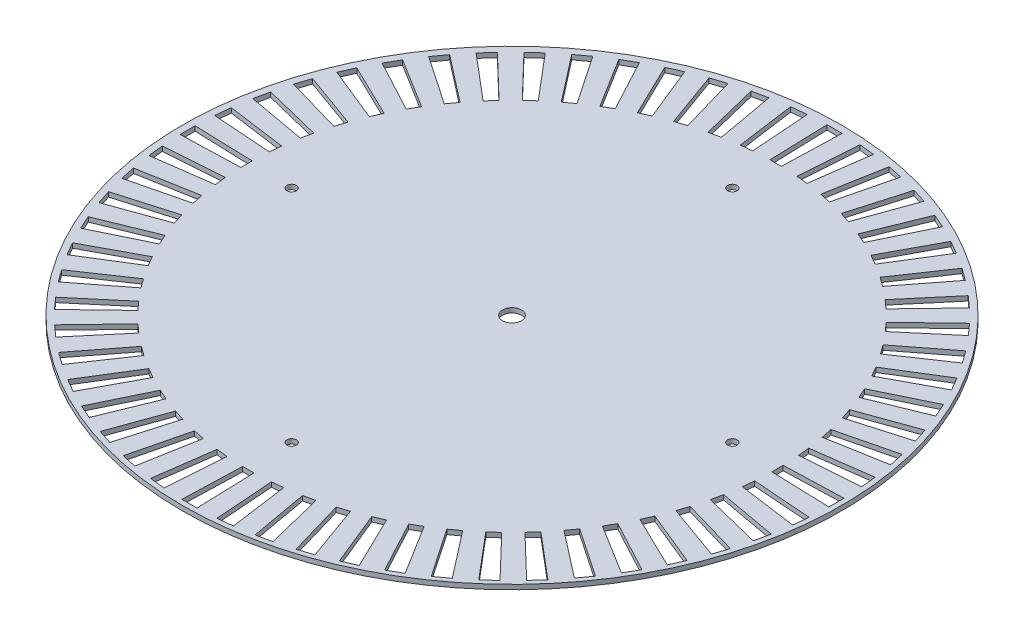
from build123d import *

# Parameters (mm, degrees)
SKETCH1_R           = 35
SKETCH1_R_2         = 1
BOSS_EXTRUDE2_DEPTH = 0.5
SKETCH2_R           = 0.5
CUT_EXTRUDE1_DEPTH  = 0.5


with BuildPart() as part:
    # Sketch1 → Boss-Extrude2 (new body)
    with BuildSketch(Plane(origin=(0, 0, 0), x_dir=(1, 0, 0), z_dir=(0, 1, 0))):
        Circle(SKETCH1_R)
        Circle(SKETCH1_R_2, mode=Mode.SUBTRACT)
    extrude(amount=BOSS_EXTRUDE2_DEPTH)

    # Sketch2 → Cut-Extrude1 (cut)
    with BuildSketch(Plane(origin=(0, 0.5, 0), x_dir=(1, 0, 0), z_dir=(0, 1, 0))):
        with Locations((0, 23.399787233)):
            Circle(SKETCH2_R)
        with Locations((23.399787233, 0)):
            Circle(SKETCH2_R)
        with Locations((0, -23.399787233)):
            Circle(SKETCH2_R)
        with Locations((-23.399787233, 0)):
            Circle(SKETCH2_R)
        Polygon((-0.8, 34.254863747), (0.8, 34.254863747), (0.6, 28.000059262), (-0.6, 28.000059262), align=None)
        Polygon((2.795991407, 34.160739826), (4.38722644, 33.993494284), (3.53451696, 27.793859966), (2.341090686, 27.919294122), align=None)
        Polygon((6.362444969, 33.691248069), (7.92748113, 33.358589364), (6.431404634, 27.282049702), (5.257627513, 27.531543731), align=None)
        Polygon((9.860285873, 32.851532328), (11.381976299, 32.357105137), (9.258924113, 26.470235972), (8.117656294, 26.841056365), align=None)
        Polygon((13.251191042, 31.650792703), (14.712863774, 31.000014074), (11.986096503, 25.367313177), (10.889841954, 25.855397148), align=None)
        Polygon((16.49800901, 30.102184748), (17.883649656, 29.302184748), (14.583042333, 23.985365169), (13.543811848, 24.585365169), align=None)
        Polygon((19.56516696, 28.222675338), (20.859594151, 27.282218934), (17.02130892, 22.33953286), (16.050488527, 23.044875163), align=None)
        Polygon((22.419060467, 26.032856769), (23.608092188, 24.962247799), (19.274182105, 20.447848333), (18.382408315, 21.250805061), align=None)
        Polygon((25.028421678, 23.556721153), (26.099030648, 22.367689432), (21.316978939, 18.33103728), (20.514022212, 19.222811071), align=None)
        Polygon((27.364661884, 20.82139755), (28.305118287, 19.526970359), (23.127318112, 16.012291926), (22.421975809, 16.983112319), align=None)
        Polygon((29.402184748, 17.856854737), (30.202184748, 16.471214091), (24.685365169, 13.517016929), (24.085365169, 14.556247414), align=None)
        Polygon((31.118666745, 14.695572866), (31.769445374, 13.233900133), (25.97404982, 10.872551046), (25.485965848, 11.968805595), align=None)
        Polygon((32.495301738, 11.372187602), (32.989728929, 9.850497176), (26.979252967, 8.107867597), (26.608432573, 9.249135416), align=None)
        Polygon((33.517007026, 7.92311065), (33.849665731, 6.358074489), (27.689961393, 5.253257033), (27.440467364, 6.427034154), align=None)
        Polygon((34.172588592, 4.386130819), (34.339834133, 2.794895786), (28.098388429, 2.339995065), (27.972954273, 3.533421339), align=None)
        Polygon((34.454863747, 0.8), (34.454863747, -0.8), (28.200059262, -0.6), (28.200059262, 0.6), align=None)
        Polygon((34.360739826, -2.795991407), (34.193494284, -4.38722644), (27.993859966, -3.53451696), (28.119294122, -2.341090686), align=None)
        Polygon((33.891248069, -6.362444969), (33.558589364, -7.92748113), (27.482049702, -6.431404634), (27.731543731, -5.257627513), align=None)
        Polygon((33.051532328, -9.860285873), (32.557105137, -11.381976299), (26.670235972, -9.258924113), (27.041056365, -8.117656293), align=None)
        Polygon((31.850792703, -13.251191042), (31.200014074, -14.712863774), (25.567313177, -11.986096503), (26.055397148, -10.889841954), align=None)
        Polygon((30.302184748, -16.49800901), (29.502184748, -17.883649656), (24.185365169, -14.583042333), (24.785365169, -13.543811848), align=None)
        Polygon((28.422675338, -19.56516696), (27.482218934, -20.859594151), (22.53953286, -17.02130892), (23.244875163, -16.050488527), align=None)
        Polygon((26.232856769, -22.419060467), (25.162247799, -23.608092188), (20.647848333, -19.274182105), (21.450805061, -18.382408315), align=None)
        Polygon((23.756721153, -25.028421678), (22.567689432, -26.099030648), (18.53103728, -21.316978939), (19.422811071, -20.514022212), align=None)
        Polygon((21.02139755, -27.364661884), (19.726970359, -28.305118287), (16.212291926, -23.127318112), (17.183112319, -22.421975809), align=None)
        Polygon((18.056854737, -29.402184748), (16.671214091, -30.202184748), (13.717016929, -24.685365169), (14.756247414, -24.085365169), align=None)
        Polygon((14.895572866, -31.118666745), (13.433900133, -31.769445374), (11.072551046, -25.97404982), (12.168805595, -25.485965848), align=None)
        Polygon((11.572187602, -32.495301738), (10.050497176, -32.989728929), (8.307867597, -26.979252967), (9.449135416, -26.608432573), align=None)
        Polygon((8.12311065, -33.517007026), (6.558074489, -33.849665731), (5.453257033, -27.689961393), (6.627034154, -27.440467364), align=None)
        Polygon((4.586130819, -34.172588592), (2.994895786, -34.339834133), (2.539995065, -28.098388429), (3.733421339, -27.972954273), align=None)
        Polygon((1, -34.454863747), (-0.6, -34.454863747), (-0.4, -28.200059262), (0.8, -28.200059262), align=None)
        Polygon((-2.595991407, -34.360739826), (-4.18722644, -34.193494284), (-3.33451696, -27.993859966), (-2.141090686, -28.119294122), align=None)
        Polygon((-6.162444969, -33.891248069), (-7.72748113, -33.558589364), (-6.231404634, -27.482049702), (-5.057627513, -27.731543731), align=None)
        Polygon((-9.660285873, -33.051532328), (-11.181976299, -32.557105137), (-9.058924113, -26.670235972), (-7.917656293, -27.041056365), align=None)
        Polygon((-13.051191042, -31.850792703), (-14.512863774, -31.200014074), (-11.786096503, -25.567313177), (-10.689841954, -26.055397148), align=None)
        Polygon((-16.29800901, -30.302184748), (-17.683649656, -29.502184748), (-14.383042333, -24.185365169), (-13.343811848, -24.785365169), align=None)
        Polygon((-19.36516696, -28.422675338), (-20.659594151, -27.482218934), (-16.82130892, -22.53953286), (-15.850488527, -23.244875163), align=None)
        Polygon((-22.219060467, -26.232856769), (-23.408092188, -25.162247799), (-19.074182105, -20.647848333), (-18.182408315, -21.450805061), align=None)
        Polygon((-24.828421678, -23.756721153), (-25.899030648, -22.567689432), (-21.116978939, -18.53103728), (-20.314022212, -19.422811071), align=None)
        Polygon((-27.164661884, -21.02139755), (-28.105118287, -19.726970359), (-22.927318112, -16.212291926), (-22.221975809, -17.183112319), align=None)
        Polygon((-29.202184748, -18.056854737), (-30.002184748, -16.671214091), (-24.485365169, -13.717016929), (-23.885365169, -14.756247414), align=None)
        Polygon((-30.918666745, -14.895572866), (-31.569445374, -13.433900133), (-25.77404982, -11.072551046), (-25.285965848, -12.168805595), align=None)
        Polygon((-32.295301738, -11.572187602), (-32.789728929, -10.050497176), (-26.779252967, -8.307867597), (-26.408432573, -9.449135416), align=None)
        Polygon((-33.317007026, -8.12311065), (-33.649665731, -6.558074489), (-27.489961393, -5.453257033), (-27.240467364, -6.627034154), align=None)
        Polygon((-33.972588592, -4.586130819), (-34.139834133, -2.994895786), (-27.898388429, -2.539995065), (-27.772954273, -3.733421339), align=None)
        Polygon((-34.254863747, -1), (-34.254863747, 0.6), (-28.000059262, 0.4), (-28.000059262, -0.8), align=None)
        Polygon((-34.160739826, 2.595991407), (-33.993494284, 4.18722644), (-27.793859966, 3.33451696), (-27.919294122, 2.141090686), align=None)
        Polygon((-33.691248069, 6.162444969), (-33.358589364, 7.72748113), (-27.282049702, 6.231404634), (-27.531543731, 5.057627513), align=None)
        Polygon((-32.851532328, 9.660285873), (-32.357105137, 11.181976299), (-26.470235972, 9.058924113), (-26.841056365, 7.917656294), align=None)
        Polygon((-31.650792703, 13.051191042), (-31.000014074, 14.512863774), (-25.367313177, 11.786096503), (-25.855397148, 10.689841954), align=None)
        Polygon((-30.102184748, 16.29800901), (-29.302184748, 17.683649656), (-23.985365169, 14.383042333), (-24.585365169, 13.343811848), align=None)
        Polygon((-28.222675338, 19.36516696), (-27.282218934, 20.659594151), (-22.33953286, 16.82130892), (-23.044875163, 15.850488527), align=None)
        Polygon((-26.032856769, 22.219060467), (-24.962247799, 23.408092188), (-20.447848333, 19.074182105), (-21.250805061, 18.182408315), align=None)
        Polygon((-23.556721153, 24.828421678), (-22.367689432, 25.899030648), (-18.33103728, 21.116978939), (-19.222811071, 20.314022212), align=None)
        Polygon((-20.82139755, 27.164661884), (-19.526970359, 28.105118287), (-16.012291926, 22.927318112), (-16.983112319, 22.221975809), align=None)
        Polygon((-17.856854737, 29.202184748), (-16.471214091, 30.002184748), (-13.517016929, 24.485365169), (-14.556247414, 23.885365169), align=None)
        Polygon((-14.695572866, 30.918666745), (-13.233900133, 31.569445374), (-10.872551046, 25.77404982), (-11.968805595, 25.285965848), align=None)
        Polygon((-11.372187602, 32.295301738), (-9.850497176, 32.789728929), (-8.107867597, 26.779252967), (-9.249135416, 26.408432573), align=None)
        Polygon((-7.92311065, 33.317007026), (-6.358074489, 33.649665731), (-5.253257033, 27.489961393), (-6.427034154, 27.240467364), align=None)
        Polygon((-4.386130819, 33.972588592), (-2.794895786, 34.139834133), (-2.339995065, 27.898388429), (-3.533421339, 27.772954273), align=None)
    extrude(amount=-CUT_EXTRUDE1_DEPTH, mode=Mode.SUBTRACT)


solid = part.part
